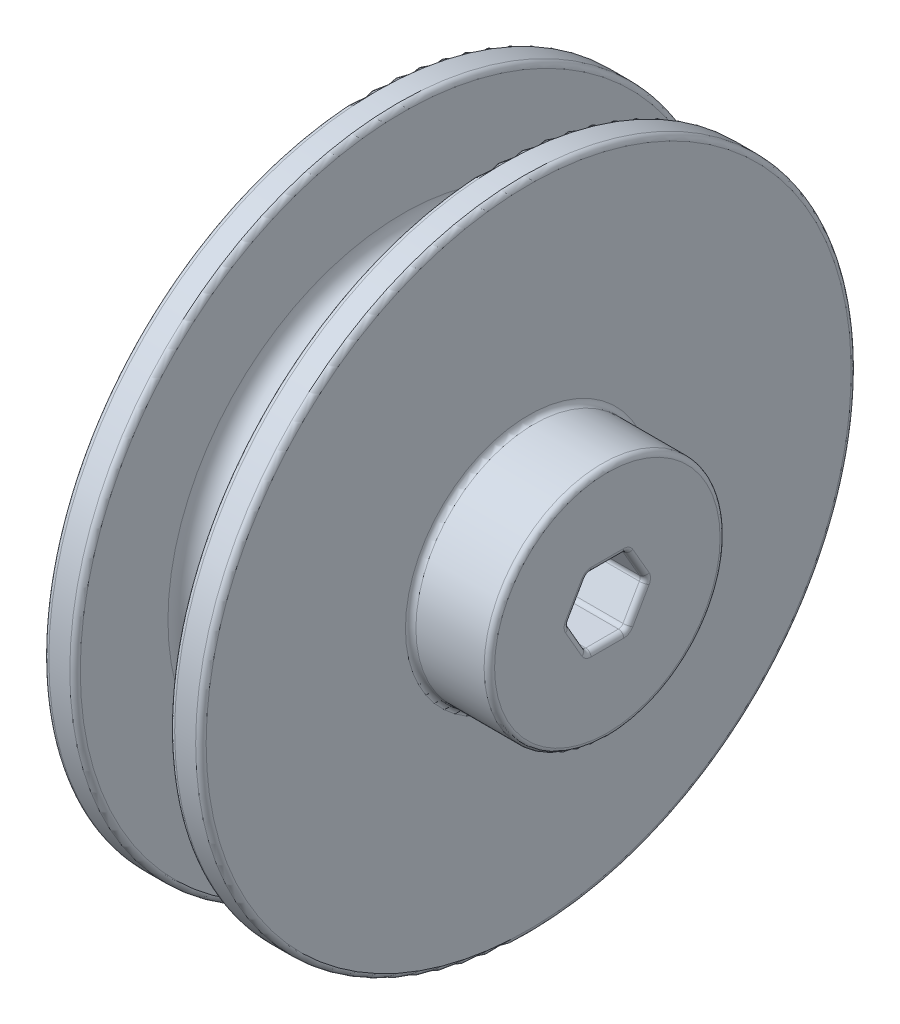
from build123d import *

# Parameters (mm, degrees)
FILLET1_R                = 2
FILLET2_R                = 0.5
CUT_SWEEP1_OUTLINE_R     = 0.75
CUT_SWEEP1_ANGLE         = 45.990948
CUT_SWEEP1_START         = 7.422509822
CUT_SWEEP1_2_OUTLINE_R   = 0.75
CUT_SWEEP1_2_DEPTH       = 8.577490178
CUT_SWEEP1_3_OUTLINE_R   = 0.75
CUT_SWEEP1_3_DEPTH       = 8.577490178
SKETCH13_R               = 1.25
CUT_EXTRUDE4_DEPTH       = 12.5
FILLET4_R                = 0.1
BOSS_EXTRUDE1_DEPTH      = 15
BOSS_EXTRUDE1_DEPTH_BACK = 15
SKETCH15_R               = 11.25
CUT_EXTRUDE8_DEPTH       = 47.670386756
CUT_EXTRUDE8_DEPTH_BACK  = 47.670386756
FILLET5_R                = 0.5


with BuildPart() as part:
    # Sketch1 → Revolve1 (revolve)
    with BuildSketch(Plane.XY, mode=Mode.PRIVATE) as revolve1_sk:
        Polygon((-7.5, 0), (-7.5, 31.25), (-4.5, 31.25), (-4.5, 20.39), (4.5, 20.39), (4.5, 31.25), (7.5, 31.25), (7.5, 0), align=None)
    revolve(revolve1_sk.sketch.rotate(Axis((-92.083333333, 0, 0), (1, 0, 0)), 90), axis=Axis((-92.083333333, 0, 0), (1, 0, 0)))

    # Fillet1
    fillet1_edges = [part.edges().sort_by_distance(p)[0] for p in [
        (4.5, 0, -20.39),
        (-4.5, 0, -20.39),
    ]]
    fillet(fillet1_edges, radius=FILLET1_R)

    # Fillet2
    fillet2_edges = [part.edges().sort_by_distance(p)[0] for p in [
        (7.5, 0, -31.25),
        (4.5, 0, -31.25),
        (-4.5, 0, -31.25),
        (-7.5, 0, -31.25),
    ]]
    fillet(fillet2_edges, radius=FILLET2_R)

    # Cut-Sweep1: read off the stored shape, not the designer's step
    # Cut-Sweep1 outline → Cut-Sweep1 (revolve, cut)
    with BuildSketch(Plane(origin=(0, 19, 0), x_dir=(0, -0.9205357142801961, 0.3906584169509844), z_dir=(0, 0.3906584169509844, 0.9205357142801961))):
        with Locations((2.5, 0)):
            Circle(CUT_SWEEP1_OUTLINE_R)
    revolve(axis=Axis((0, 19, 0), (1, 0, 0)), revolution_arc=CUT_SWEEP1_ANGLE, mode=Mode.SUBTRACT)

    # Cut-Sweep1 2 outline → Cut-Sweep1 2 (cut)
    with BuildSketch(Plane(origin=(0, 0, 0), x_dir=(1, 0, 0), z_dir=(0, 0.3906584169509792, -0.9205357142801984)).offset(CUT_SWEEP1_START)):
        with Locations((0, -14.990178571)):
            Circle(CUT_SWEEP1_2_OUTLINE_R)
    extrude(amount=CUT_SWEEP1_2_DEPTH, mode=Mode.SUBTRACT)

    # Cut-Sweep1 3 outline → Cut-Sweep1 3 (cut)
    with BuildSketch(Plane(origin=(0, 0, 0), x_dir=(1, 0, 0), z_dir=(0, 0.39065841695098, 0.920535714280198)).offset(CUT_SWEEP1_START)):
        with Locations((0, 14.990178571)):
            Circle(CUT_SWEEP1_3_OUTLINE_R)
    extrude(amount=CUT_SWEEP1_3_DEPTH, mode=Mode.SUBTRACT)

    # Sketch13 → Cut-Extrude4 (cut)
    with BuildSketch(Plane(origin=(0, 8.75954223, 20.640721187), x_dir=(1, 0, 0), z_dir=(0, 0.39065841695097747, 0.9205357142801991))):
        with Locations(Location((0, 14.990178571, 0), (0, 0, 270))):
            Circle(SKETCH13_R)
    extrude(amount=-CUT_EXTRUDE4_DEPTH, mode=Mode.SUBTRACT)

    # Fillet4
    fillet4_edges = [part.edges().sort_by_distance(p)[0] for p in [
        (-0.749235119, 19.215450732, -6.820451098),
        (0, 18.8259764, 2.789662307),
        (-0.75, 17.675306756, 3.277985328),
    ]]
    fillet(fillet4_edges, radius=FILLET4_R)

    # Sketch15 → Boss-Extrude1 (add, two sides: drawn at the far end of the back side and taken through both)
    with BuildSketch(Plane(origin=(0, 0, 0), x_dir=(0, 0, -1), z_dir=(1, 0, 0)).offset(-BOSS_EXTRUDE1_DEPTH_BACK)):
        with Locations(Location((0, 0, 0), (0, 0, 180))):
            Circle(SKETCH15_R)
    extrude(amount=BOSS_EXTRUDE1_DEPTH + BOSS_EXTRUDE1_DEPTH_BACK)

    # Sketch19 → Cut-Extrude8 (cut, two sides: drawn at the far end of the back side and taken through both)
    with BuildSketch(Plane(origin=(0, 0, 0), x_dir=(0, 0, -1), z_dir=(1, 0, 0)).offset(-CUT_EXTRUDE8_DEPTH_BACK)):
        Polygon((1.847520861, 3.2), (-1.847520861, 3.2), (-3.695041723, 0), (-1.847520861, -3.2), (1.847520861, -3.2), (3.695041723, 0), align=None)
    extrude(amount=CUT_EXTRUDE8_DEPTH + CUT_EXTRUDE8_DEPTH_BACK, mode=Mode.SUBTRACT)

    # Fillet5
    fillet5_edges = [part.edges().sort_by_distance(p)[0] for p in [
        (7.5, 0, -11.25),
        (-7.5, 0, -11.25),
        (15, 0, -11.25),
        (-15, 0, -11.25),
        (0, 3.2, -1.847520861),
        (-15, 1.6, -2.771281292),
        (0, 0, -3.695041723),
        (-15, -1.6, -2.771281292),
        (0, -3.2, -1.847520861),
        (-15, -3.2, 0),
        (0, -3.2, 1.847520861),
        (-15, -1.6, 2.771281292),
        (0, 0, 3.695041723),
        (-15, 1.6, 2.771281292),
        (0, 3.2, 1.847520861),
        (-15, 3.2, 0),
        (15, 1.6, -2.771281292),
        (15, 3.2, 0),
        (15, 1.6, 2.771281292),
        (15, -1.6, 2.771281292),
        (15, -3.2, 0),
        (15, -1.6, -2.771281292),
    ]]
    fillet(fillet5_edges, radius=FILLET5_R)


solid = part.part
